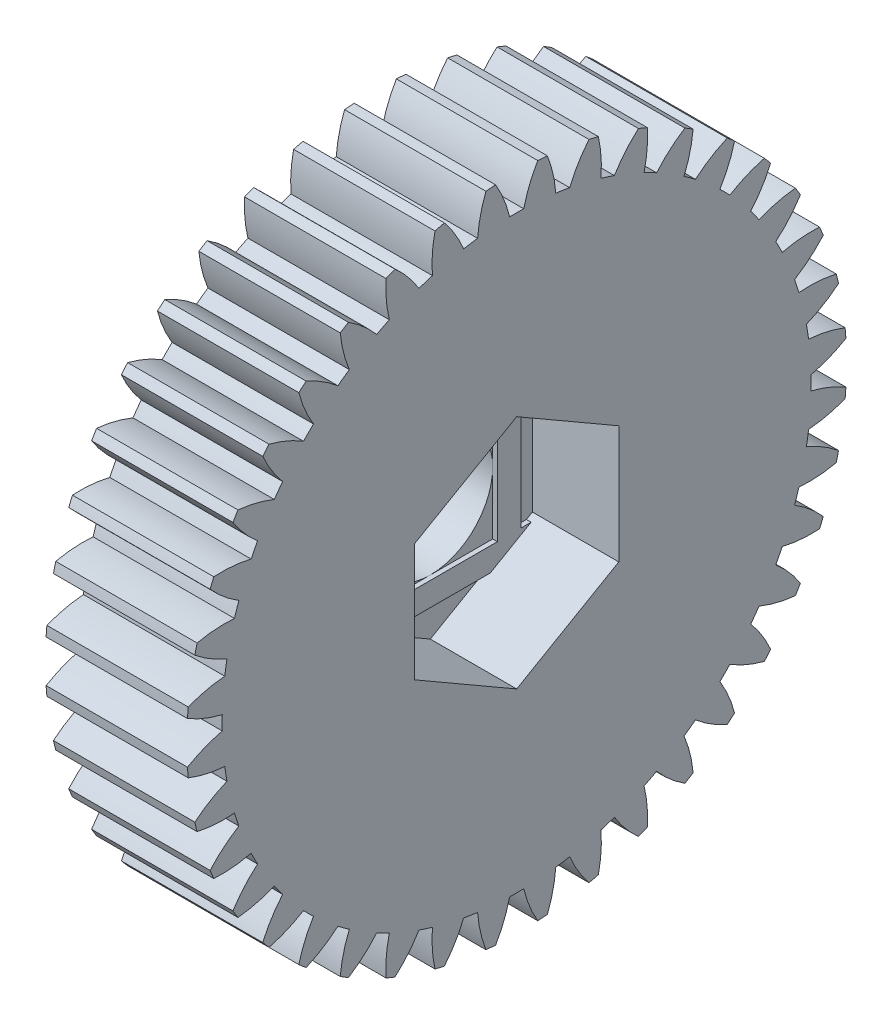
from build123d import *

# Parameters (mm, degrees)
BASPROSKE_W         = 9
BASPROSKE_H         = 21
TOOTHCUT_DEPTH      = 32.032241298
TEETHCUTS_COUNT     = 40
TEETHCUTS_ANGLE     = 351
BORSKE_R            = 2
BORE_DEPTH          = 50.0000508
CUT_EXTRUDE1_DEPTH  = 5.5
SKETCH1_7_R         = 3.9725
CUT_EXTRUDE2_DEPTH  = 31.974304622
SKETCH2_R           = 6
SKETCH2_R_2         = 4
BOSS_EXTRUDE1_DEPTH = 1.3
SKETCH3_W           = 7.945
SKETCH3_H           = 7.945
BOSS_EXTRUDE2_DEPTH = 0.3


with BuildPart() as part:
    # BasProSke → Base-Revolve (revolve)
    with BuildSketch(Plane(origin=(0, 0, 0), x_dir=(1, 0, 0), z_dir=(0, 1, 0))):
        with Locations((4.5, 10.5)):
            Rectangle(BASPROSKE_W, BASPROSKE_H)
    revolve(axis=Axis((-10, 0, 0), (1, 0, 0)))

    # TooCutSke → ToothCut (cut, through all)
    with BuildSketch(Plane(origin=(0, 0, 0), x_dir=(0, 0, -1), z_dir=(1, 0, 0))):
        with BuildLine():
            ThreePointArc((0.448673268, 18.74363074), (0, 18.749), (-0.448673268, 18.74363074))
            ThreePointArc((-0.448673268, 18.74363074), (-0.816786816, 19.89705013), (-1.354745081, 20.981708961))
            ThreePointArc((-1.354745081, 20.981708961), (0, 21.0254), (1.354745081, 20.981708961))
            ThreePointArc((1.354745081, 20.981708961), (0.816786816, 19.89705013), (0.448673268, 18.74363074))
        make_face()
    toothcut = extrude(amount=TOOTHCUT_DEPTH, mode=Mode.SUBTRACT)

    # TeethCuts: ToothCut ×40 about axis
    teethcuts_axis = Axis((-10, 0, 0), (1, 0, 0))
    for i in range(1, TEETHCUTS_COUNT):
        add(toothcut.rotate(teethcuts_axis, i * TEETHCUTS_ANGLE / (TEETHCUTS_COUNT - 1)), mode=Mode.SUBTRACT)

    # BorSke → Bore (cut, symmetric)
    with BuildSketch(Plane(origin=(0, 0, 0), x_dir=(0, 0, -1), z_dir=(1, 0, 0))):
        Circle(BORSKE_R)
    extrude(amount=BORE_DEPTH, both=True, mode=Mode.SUBTRACT)

    # Sketch1 → Cut-Extrude1 (cut)
    with BuildSketch(Plane(origin=(9, 0, 0), x_dir=(0, 0, -1), z_dir=(1, 0, 0))):
        Polygon((0, 7.505553499), (-6.5, 3.75277675), (-6.5, -3.75277675), (0, -7.505553499), (6.5, -3.75277675), (6.5, 3.75277675), align=None)
    extrude(amount=-CUT_EXTRUDE1_DEPTH, mode=Mode.SUBTRACT)

    # Sketch1<7> → Cut-Extrude2 (cut, through all)
    with BuildSketch(Plane(origin=(9, 0, 0), x_dir=(0, 0, -1), z_dir=(1, 0, 0))):
        Circle(SKETCH1_7_R)
    extrude(amount=-CUT_EXTRUDE2_DEPTH, mode=Mode.SUBTRACT)

    # Sketch2 → Boss-Extrude1 (add)
    with BuildSketch(Plane.ZY):
        Circle(SKETCH2_R)
        Circle(SKETCH2_R_2, mode=Mode.SUBTRACT)
    extrude(amount=BOSS_EXTRUDE1_DEPTH)

    # Sketch3 → Boss-Extrude2 (add)
    with BuildSketch(Plane(origin=(3.5, 0, 0), x_dir=(0, 0, -1), z_dir=(1, 0, 0))):
        Polygon((5.4725, -3.9725), (5.4725, 3.9725), (6.119428167, 3.9725), (3.521351956, 5.4725), (-3.521351956, 5.4725), (-6.119428167, 3.9725), (-5.4725, 3.9725), (-5.4725, -3.9725), (-6.119428167, -3.9725), (-3.521351956, -5.4725), (3.521351956, -5.4725), (6.119428167, -3.9725), align=None)
        Rectangle(SKETCH3_W, SKETCH3_H, mode=Mode.SUBTRACT)
    extrude(amount=BOSS_EXTRUDE2_DEPTH)


solid = part.part
